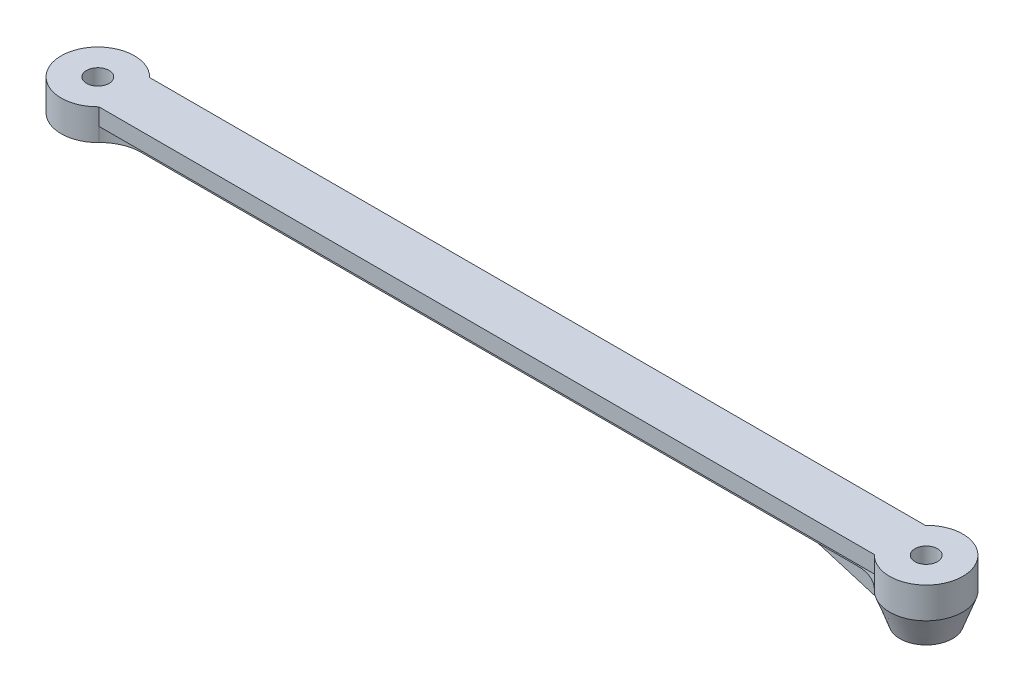
from build123d import *

# Parameters (mm, degrees)
SKETCH1_R           = 2
BOSS_EXTRUDE1_DEPTH = 5.5
CUT_EXTRUDE1_DEPTH  = 2.5
SKETCH4_R           = 6.5
SKETCH3_R           = 4.68
SKETCH5_R           = 2
CUT_EXTRUDE2_DEPTH  = 154.995941509
BOSS_EXTRUDE2_DEPTH = 1.25


with BuildPart() as part:
    # Sketch1 → Boss-Extrude1 (new body)
    with BuildSketch(Plane(origin=(0, 0, 0), x_dir=(1, 0, 0), z_dir=(0, 1, 0))):
        with BuildLine():
            Line((-142.30958424, 4.5), (-4.69041576, 4.5))
            ThreePointArc((-4.69041576, 4.5), (6.5, 0), (-4.69041576, -4.5))
            Line((-4.69041576, -4.5), (-142.30958424, -4.5))
            ThreePointArc((-142.30958424, -4.5), (-153.5, 0), (-142.30958424, 4.5))
        make_face()
        Circle(SKETCH1_R, mode=Mode.SUBTRACT)
        with Locations((-147, 0)):
            Circle(SKETCH1_R, mode=Mode.SUBTRACT)
    extrude(amount=BOSS_EXTRUDE1_DEPTH)

    # Sketch2 → Cut-Extrude1 (cut)
    with BuildSketch(Plane.XZ):
        with BuildLine():
            Line((-9.96713349, 2.25), (-137.03286651, 2.25))
            ThreePointArc((-137.03286651, 2.25), (-139.901064987, 2.835978332), (-142.30958424, 4.5))
            Line((-142.30958424, 4.5), (-4.69041576, 4.5))
            ThreePointArc((-4.69041576, 4.5), (-7.098935013, 2.835978332), (-9.96713349, 2.25))
        make_face()
        with BuildLine():
            Line((-9.96713349, -2.25), (-137.03286651, -2.25))
            ThreePointArc((-137.03286651, -2.25), (-139.901064987, -2.835978332), (-142.30958424, -4.5))
            Line((-142.30958424, -4.5), (-4.69041576, -4.5))
            ThreePointArc((-4.69041576, -4.5), (-7.098935013, -2.835978332), (-9.96713349, -2.25))
        make_face()
    extrude(amount=-CUT_EXTRUDE1_DEPTH, mode=Mode.SUBTRACT)

    # Sketch4 → Loft1 section 0
    with BuildSketch(Plane.XZ):
        Circle(SKETCH4_R)
    # Sketch3 → Loft1 section 1
    with BuildSketch(Plane(origin=(0, -5, 0), x_dir=(-1, 0, 0), z_dir=(0, -1, 0))):
        Circle(SKETCH3_R)
    loft()

    # Sketch5 → Cut-Extrude2 (cut, through all)
    with BuildSketch(Plane.XZ.offset(5)):
        Circle(SKETCH5_R)
    extrude(amount=-CUT_EXTRUDE2_DEPTH, mode=Mode.SUBTRACT)

    # Sketch6 → Boss-Extrude2 (add, symmetric)
    with BuildSketch(Plane.XY):
        Polygon((-3.080000032, 0), (-21.280000032, 0), (-4.680000032, -5), (-3.080000032, -5), align=None)
    extrude(amount=BOSS_EXTRUDE2_DEPTH, both=True)


solid = part.part
